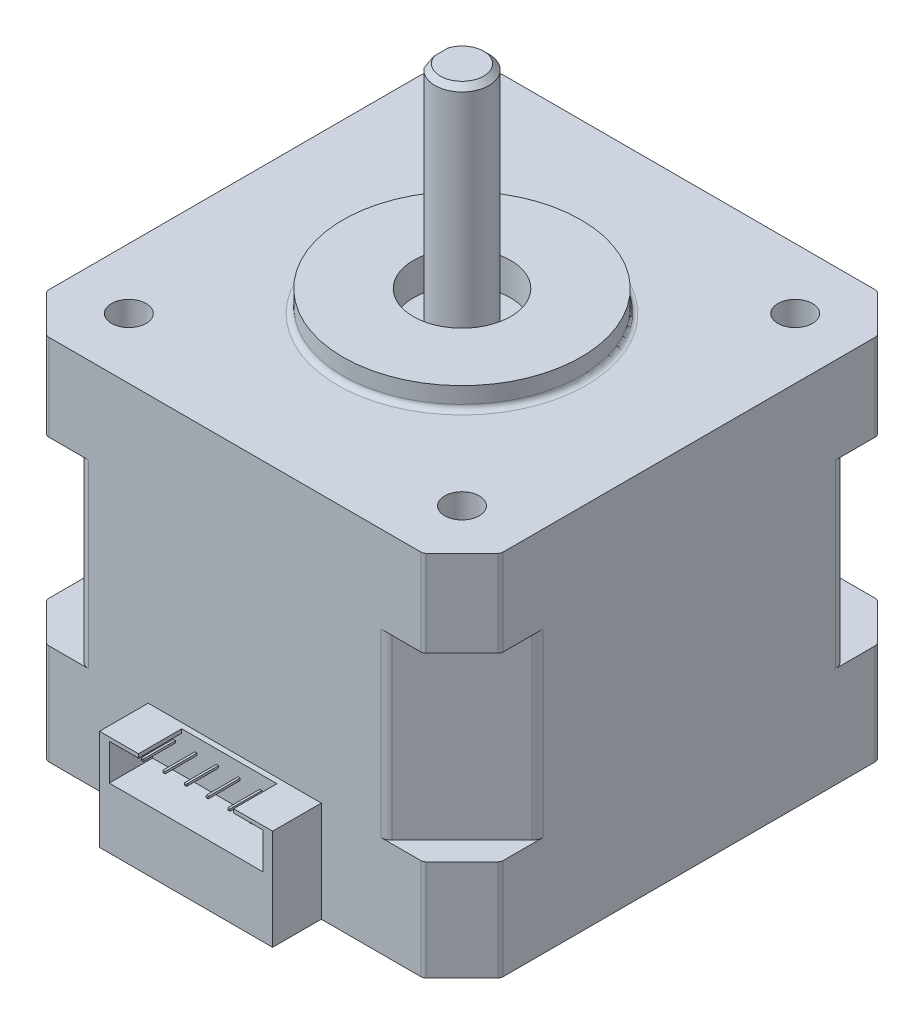
from build123d import *

# Parameters (mm, degrees)
SZKIC1_W                          = 42
SZKIC1_H                          = 42
DODANIE_WYCI_GNI_CIE1_DEPTH       = 9.3
SFAZOWANIE1_SIZE                  = 3.6
ZAOKR_GLENIE1_R                   = 0.5
SZKIC2_W                          = 42
SZKIC2_H                          = 42
DODANIE_WYCI_GNI_CIE2_DEPTH       = 16.7
WYTNIJ_WYCI_GNI_CIE1_DEPTH        = 16.7
ZAOKR_GLENIE2_R                   = 1
SZKIC3_W                          = 42
SZKIC3_H                          = 42
DODANIE_WYCI_GNI_CIE3_DEPTH       = 8
SFAZOWANIE3_SIZE                  = 3.6
ZAOKR_GLENIE3_R                   = 0.5
SZKIC5_R                          = 4.5
WYTNIJ_WYCI_GNI_CIE2_DEPTH        = 4
SZKIC6_R                          = 3
WYTNIJ_WYCI_GNI_CIE3_DEPTH        = 8
SZKIC7_R                          = 1.6
WYTNIJ_WYCI_GNI_CIE4_DEPTH        = 69.439754529
SZKIC20_R                         = 11
DODANIE_WYCI_GNI_CIE4_DEPTH       = 2
ZAOKR_GLENIE4_R                   = 0.5
WYTNIJ_WYCI_GNI_CIE6_START        = -3
SZKIC21_R                         = 4.5
WYTNIJ_WYCI_GNI_CIE6_DEPTH        = 3
DODANIE_WYCI_GNI_CIE5_DEPTH       = 21
SFAZOWANIE4_SIZE                  = 0.5
SZKIC23_W                         = 16
SZKIC23_H                         = 9.3
DODANIE_WYCI_GNI_CIE6_DEPTH       = 4.5
WYTNIJ_WYCI_GNI_CIE7_DEPTH        = 4
SZKIC25_W                         = 0.2
SZKIC25_H                         = 0.2
WYCI_GNI_CIE_CIENKA_CIANKA2_DEPTH = 3
ZAOKR_GLENIE6_R                   = 0.1


with BuildPart() as part:
    # Szkic1 → Dodanie-wyciągnięcie1 (new body)
    with BuildSketch(Plane(origin=(0, 0, 0), x_dir=(1, 0, 0), z_dir=(0, 1, 0))):
        with Locations((21, 21)):
            Rectangle(SZKIC1_W, SZKIC1_H)
    extrude(amount=DODANIE_WYCI_GNI_CIE1_DEPTH)

    # Sfazowanie1
    sfazowanie1_edges = [part.edges().sort_by_distance(p)[0] for p in [
        (0, 4.65, -42),
        (42, 4.65, -42),
        (42, 4.65, 0),
        (0, 4.65, 0),
    ]]
    chamfer(sfazowanie1_edges, length=SFAZOWANIE1_SIZE)

    # Zaokrąglenie1
    zaokr_glenie1_edges = [part.edges().sort_by_distance(p)[0] for p in [
        (0, 4.65, -3.6),
        (0, 4.65, -38.4),
        (38.4, 4.65, -42),
        (3.6, 4.65, -42),
        (38.4, 4.65, 0),
        (3.6, 4.65, 0),
        (42, 4.65, -3.6),
        (42, 4.65, -38.4),
    ]]
    fillet(zaokr_glenie1_edges, radius=ZAOKR_GLENIE1_R)

    # Szkic2 → Dodanie-wyciągnięcie2 (add)
    with BuildSketch(Plane(origin=(0, 9.3, 0), x_dir=(1, 0, 0), z_dir=(0, 1, 0))):
        with Locations((21, 21)):
            Rectangle(SZKIC2_W, SZKIC2_H)
    extrude(amount=DODANIE_WYCI_GNI_CIE2_DEPTH)

    # Szkic4 → Wytnij-wyciągnięcie1 (cut)
    with BuildSketch(Plane(origin=(0, 26, 0), x_dir=(1, 0, 0), z_dir=(0, 1, 0))):
        Polygon((34.928932188, 0), (42, 7.071067812), (42, 0), align=None)
        Polygon((42, 34.928932188), (42, 42), (34.928932188, 42), align=None)
        Polygon((7.071067812, 42), (0, 34.928932188), (0, 42), align=None)
        Polygon((0, 7.071067812), (0, 0), (7.071067812, 0), align=None)
    extrude(amount=-WYTNIJ_WYCI_GNI_CIE1_DEPTH, mode=Mode.SUBTRACT)

    # Zaokrąglenie2
    zaokr_glenie2_edges = [part.edges().sort_by_distance(p)[0] for p in [
        (0, 17.65, -7.071067812),
        (7.071067812, 17.65, 0),
        (7.071067812, 17.65, -42),
        (0, 17.65, -34.928932188),
        (42, 17.65, -34.928932188),
        (34.928932188, 17.65, -42),
        (34.928932188, 17.65, 0),
        (42, 17.65, -7.071067812),
    ]]
    fillet(zaokr_glenie2_edges, radius=ZAOKR_GLENIE2_R)

    # Szkic3 → Dodanie-wyciągnięcie3 (add)
    with BuildSketch(Plane(origin=(0, 26, 0), x_dir=(1, 0, 0), z_dir=(0, 1, 0))):
        with Locations((21, 21)):
            Rectangle(SZKIC3_W, SZKIC3_H)
    extrude(amount=DODANIE_WYCI_GNI_CIE3_DEPTH)

    # Sfazowanie3
    sfazowanie3_edges = [part.edges().sort_by_distance(p)[0] for p in [
        (0, 30, -42),
        (0, 30, 0),
        (42, 30, 0),
        (42, 30, -42),
    ]]
    chamfer(sfazowanie3_edges, length=SFAZOWANIE3_SIZE)

    # Zaokrąglenie3
    zaokr_glenie3_edges = [part.edges().sort_by_distance(p)[0] for p in [
        (38.4, 30, 0),
        (3.6, 30, 0),
        (0, 30, -38.4),
        (0, 30, -3.6),
        (38.4, 30, -42),
        (3.6, 30, -42),
        (42, 30, -38.4),
        (42, 30, -3.6),
    ]]
    fillet(zaokr_glenie3_edges, radius=ZAOKR_GLENIE3_R)

    # Szkic5 → Wytnij-wyciągnięcie2 (cut)
    with BuildSketch(Plane.XZ):
        with Locations(Location((21, -21, 0), (0, 0, 270))):
            Circle(SZKIC5_R)
    extrude(amount=-WYTNIJ_WYCI_GNI_CIE2_DEPTH, mode=Mode.SUBTRACT)

    # Szkic6 → Wytnij-wyciągnięcie3 (cut)
    with BuildSketch(Plane.XZ):
        with Locations(Location((5.6, -5.6, 0), (0, 0, 270))):
            Circle(SZKIC6_R)
        with Locations(Location((36.4, -5.6, 0), (0, 0, 90))):
            Circle(SZKIC6_R)
        with Locations(Location((36.4, -36.4, 0), (0, 0, 270))):
            Circle(SZKIC6_R)
        with Locations(Location((5.6, -36.4, 0), (0, 0, 90))):
            Circle(SZKIC6_R)
    extrude(amount=-WYTNIJ_WYCI_GNI_CIE3_DEPTH, mode=Mode.SUBTRACT)

    # Szkic7 → Wytnij-wyciągnięcie4 (cut, through all)
    with BuildSketch(Plane(origin=(0, 34, 0), x_dir=(1, 0, 0), z_dir=(0, 1, 0))):
        with Locations(Location((36.4, 5.6, 0), (0, 0, 270))):
            Circle(SZKIC7_R)
        with Locations(Location((5.6, 5.6, 0), (0, 0, 90))):
            Circle(SZKIC7_R)
        with Locations(Location((5.6, 36.4, 0), (0, 0, 270))):
            Circle(SZKIC7_R)
        with Locations(Location((36.4, 36.4, 0), (0, 0, 90))):
            Circle(SZKIC7_R)
    extrude(amount=-WYTNIJ_WYCI_GNI_CIE4_DEPTH, mode=Mode.SUBTRACT)

    # Szkic20 → Dodanie-wyciągnięcie4 (add)
    with BuildSketch(Plane(origin=(0, 34, 0), x_dir=(1, 0, 0), z_dir=(0, 1, 0))):
        with Locations(Location((21, 21, 0), (0, 0, 90))):
            Circle(SZKIC20_R)
    extrude(amount=DODANIE_WYCI_GNI_CIE4_DEPTH)

    # Zaokrąglenie4
    zaokr_glenie4_edges = [part.edges().sort_by_distance(p)[0] for p in [
        (21, 34, -10),
    ]]
    fillet(zaokr_glenie4_edges, radius=ZAOKR_GLENIE4_R)

    # Szkic21 → Wytnij-wyciągnięcie6 (cut)
    with BuildSketch(Plane(origin=(0, 36, 0), x_dir=(1, 0, 0), z_dir=(0, 1, 0)).offset(WYTNIJ_WYCI_GNI_CIE6_START)):
        with Locations(Location((21, 21, 0), (0, 0, 90))):
            Circle(SZKIC21_R)
    extrude(amount=WYTNIJ_WYCI_GNI_CIE6_DEPTH, mode=Mode.SUBTRACT)

    # Szkic22 → Dodanie-wyciągnięcie5 (add)
    with BuildSketch(Plane(origin=(0, 33, 0), x_dir=(1, 0, 0), z_dir=(0, 1, 0))):
        with BuildLine():
            Line((19.1, 19.375192319), (19.1, 22.624807681))
            ThreePointArc((19.1, 22.624807681), (23.5, 21), (19.1, 19.375192319))
        make_face()
    extrude(amount=DODANIE_WYCI_GNI_CIE5_DEPTH)

    # Sfazowanie4
    sfazowanie4_edges = [part.edges().sort_by_distance(p)[0] for p in [
        (23.5, 54, -21),
    ]]
    chamfer(sfazowanie4_edges, length=SFAZOWANIE4_SIZE)

    # Szkic23 → Dodanie-wyciągnięcie6 (add)
    with BuildSketch(Plane.XY):
        with Locations((20.992893219, 4.65)):
            Rectangle(SZKIC23_W, SZKIC23_H)
    extrude(amount=DODANIE_WYCI_GNI_CIE6_DEPTH)

    # Szkic24 → Wytnij-wyciągnięcie7 (cut)
    with BuildSketch(Plane.XY.offset(4.5)):
        Polygon((16.592893219, 9.3), (16.592893219, 8.95), (13.892893219, 8.95), (13.892893219, 5.6), (28.092893219, 5.6), (28.092893219, 8.95), (25.392893219, 8.95), (25.392893219, 9.3), align=None)
    extrude(amount=-WYTNIJ_WYCI_GNI_CIE7_DEPTH, mode=Mode.SUBTRACT)

    # Szkic25 → Wyciągnięcie-cienka ścianka2 (add)
    with BuildSketch(Plane.XY.offset(0.5)):
        with Locations((15.892893219, 7.95284256)):
            Rectangle(SZKIC25_W, SZKIC25_H)
        with Locations((17.892893219, 7.95284256)):
            Rectangle(SZKIC25_W, SZKIC25_H)
        with Locations((19.892893219, 7.95284256)):
            Rectangle(SZKIC25_W, SZKIC25_H)
        with Locations((21.892893219, 7.95284256)):
            Rectangle(SZKIC25_W, SZKIC25_H)
        with Locations((23.892893219, 7.95284256)):
            Rectangle(SZKIC25_W, SZKIC25_H)
        with Locations((25.892893219, 7.95284256)):
            Rectangle(SZKIC25_W, SZKIC25_H)
    extrude(amount=WYCI_GNI_CIE_CIENKA_CIANKA2_DEPTH)

    # Zaokrąglenie6
    zaokr_glenie6_edges = [part.edges().sort_by_distance(p)[0] for p in [
        (19.892893219, 7.85284256, 3.5),
        (19.992893219, 7.95284256, 3.5),
        (19.892893219, 8.05284256, 3.5),
        (19.792893219, 7.95284256, 3.5),
        (15.892893219, 7.85284256, 3.5),
        (15.992893219, 7.95284256, 3.5),
        (15.892893219, 8.05284256, 3.5),
        (15.792893219, 7.95284256, 3.5),
        (17.892893219, 7.85284256, 3.5),
        (17.992893219, 7.95284256, 3.5),
        (17.892893219, 8.05284256, 3.5),
        (17.792893219, 7.95284256, 3.5),
        (21.892893219, 7.85284256, 3.5),
        (21.992893219, 7.95284256, 3.5),
        (21.892893219, 8.05284256, 3.5),
        (21.792893219, 7.95284256, 3.5),
        (23.892893219, 7.85284256, 3.5),
        (23.992893219, 7.95284256, 3.5),
        (23.892893219, 8.05284256, 3.5),
        (23.792893219, 7.95284256, 3.5),
        (25.892893219, 7.85284256, 3.5),
        (25.992893219, 7.95284256, 3.5),
        (25.892893219, 8.05284256, 3.5),
        (25.792893219, 7.95284256, 3.5),
    ]]
    fillet(zaokr_glenie6_edges, radius=ZAOKR_GLENIE6_R - 0.0001)  # a hair under: the kernel refuses the full size


solid = part.part
